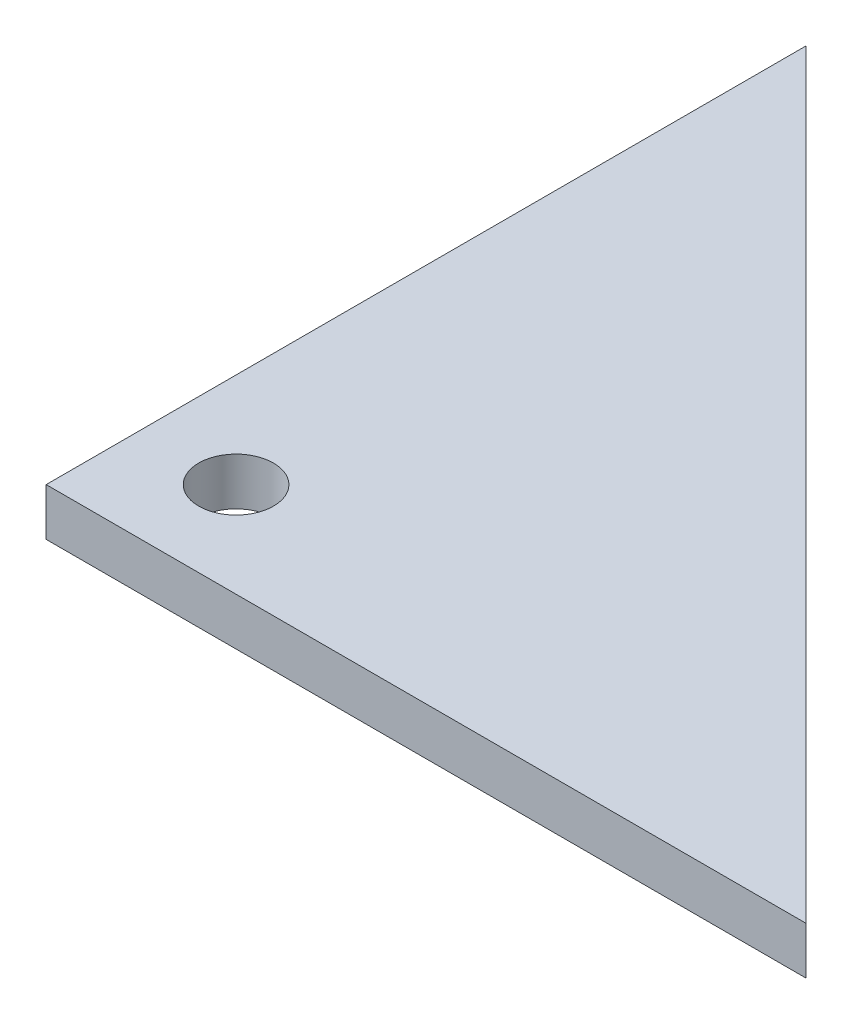
from build123d import *

# Parameters (mm, degrees)
BOSS_EXTRUDE1_DEPTH = 3.175
SKETCH2_R           = 2.5
CUT_EXTRUDE1_DEPTH  = 72.912172996


with BuildPart() as part:
    # Sketch1 → Boss-Extrude1 (new body)
    with BuildSketch(Plane(origin=(0, 0, 0), x_dir=(1, 0, 0), z_dir=(0, 1, 0))):
        Polygon((0, 0), (50.8, 0), (0, 50.8), align=None)
    extrude(amount=BOSS_EXTRUDE1_DEPTH)

    # Sketch2 → Cut-Extrude1 (cut, through all)
    with BuildSketch(Plane(origin=(0, 3.175, 0), x_dir=(1, 0, 0), z_dir=(0, 1, 0))):
        with Locations((6.35, 6.35)):
            Circle(SKETCH2_R)
    extrude(amount=-CUT_EXTRUDE1_DEPTH, mode=Mode.SUBTRACT)


solid = part.part
